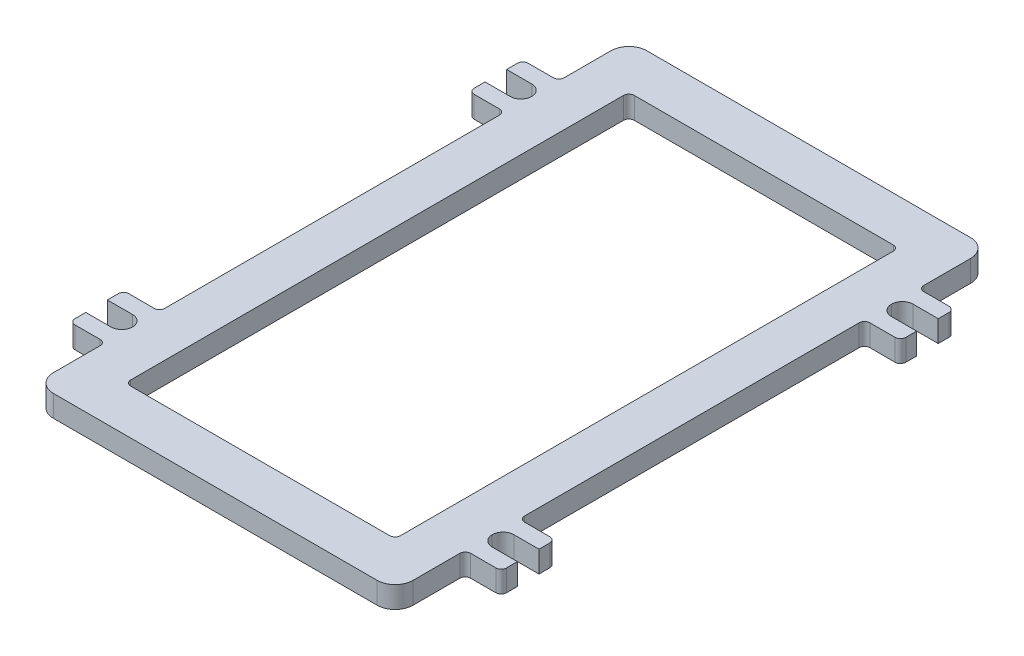
from build123d import *

# Parameters (mm, degrees)
BOSS_EXTRUDE1_DEPTH  = 12
BOSS_EXTRUDE2_DEPTH  = 12
MIRROR4_COPY_1_DEPTH = 12
FILLET3_R            = 6
FILLET4_R            = 3


with BuildPart() as part:
    # Sketch2 → Boss-Extrude1 (new body)
    with BuildSketch(Plane(origin=(0, 0, 0), x_dir=(1, 0, 0), z_dir=(0, 1, 0))):
        with BuildLine():
            Line((-90, -165), (90, -165))
            ThreePointArc((90, -165), (97.071067812, -162.071067812), (100, -155))
            Line((100, -155), (100, 155))
            ThreePointArc((100, 155), (97.071067812, 162.071067812), (90, 165))
            Line((90, 165), (-90, 165))
            ThreePointArc((-90, 165), (-97.071067812, 162.071067812), (-100, 155))
            Line((-100, 155), (-100, -155))
            ThreePointArc((-100, -155), (-97.071067812, -162.071067812), (-90, -165))
        make_face()
        with BuildLine():
            Line((-72, -140), (72, -140))
            ThreePointArc((72, -140), (74.121320344, -139.121320344), (75, -137))
            Line((75, -137), (75, 137))
            ThreePointArc((75, 137), (74.121320344, 139.121320344), (72, 140))
            Line((72, 140), (-72, 140))
            ThreePointArc((-72, 140), (-74.121320344, 139.121320344), (-75, 137))
            Line((-75, 137), (-75, -137))
            ThreePointArc((-75, -137), (-74.121320344, -139.121320344), (-72, -140))
        make_face(mode=Mode.SUBTRACT)
    extrude(amount=BOSS_EXTRUDE1_DEPTH)

    # Sketch3 → Boss-Extrude2 (add)
    with BuildSketch(Plane(origin=(0, 0, 0), x_dir=(1, 0, 0), z_dir=(0, 1, 0))):
        Polygon((75, 126), (120, 126), (120, 117), (97, 117), (97, 105), (120, 105), (120, 96), (75, 96), align=None)
    boss_extrude2 = extrude(amount=BOSS_EXTRUDE2_DEPTH)

    # Mirror3: Boss-Extrude2 across plane
    add(boss_extrude2.mirror(Plane(origin=(0, 0, 0), x_dir=(0, 0, 1), z_dir=(1, 0, 0))))

    # Mirror4: Boss-Extrude2 across plane
    add(boss_extrude2.mirror(Plane.XY))

    # Mirror4 copy 1 sketch → Mirror4 copy 1 (add)
    with BuildSketch(Plane(origin=(0, 0, 0), x_dir=(-1, 0, 0), z_dir=(0, 1, 0))):
        Polygon((75, 126), (120, 126), (120, 117), (97, 117), (97, 105), (120, 105), (120, 96), (75, 96), align=None)
    extrude(amount=MIRROR4_COPY_1_DEPTH)

    # Fillet3
    fillet3_edges = [part.edges().sort_by_distance(p)[0] for p in [
        (-100, 6, 117),
        (-100, 6, 105),
        (100, 6, 117),
        (100, 6, 105),
        (100, 6, -105),
        (100, 6, -117),
        (-100, 6, -105),
        (-100, 6, -117),
    ]]
    fillet(fillet3_edges, radius=FILLET3_R - 0.0001)  # a hair under: the kernel refuses the full size

    # Fillet4
    fillet4_edges = [part.edges().sort_by_distance(p)[0] for p in [
        (-120, 6, -96),
        (-120, 6, -126),
        (-100, 6, -96),
        (-100, 6, -126),
        (120, 6, 96),
        (120, 6, 126),
        (100, 6, 96),
        (100, 6, 126),
        (-100, 6, 126),
        (-120, 6, 126),
        (-100, 6, 96),
        (-120, 6, 96),
        (100, 6, -126),
        (120, 6, -126),
        (100, 6, -96),
        (120, 6, -96),
    ]]
    fillet(fillet4_edges, radius=FILLET4_R)


solid = part.part
